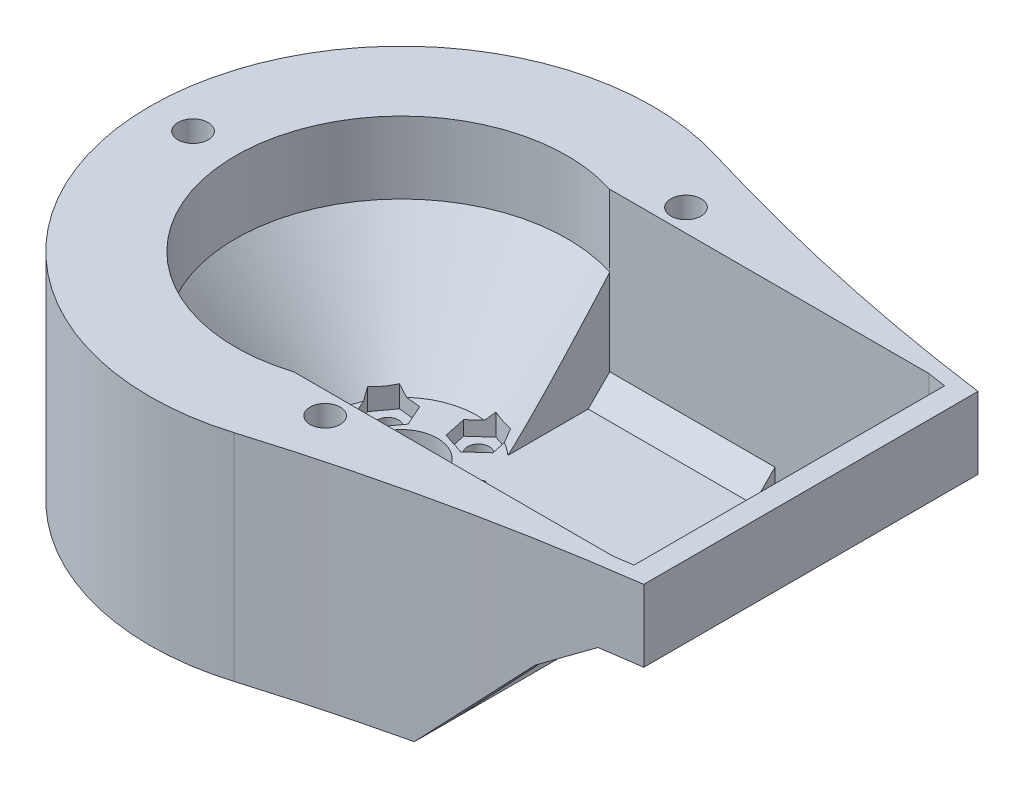
from build123d import *
from OCP.BRepFilletAPI import BRepFilletAPI_MakeChamfer

# Parameters (mm, degrees)
BOSS_EXTRUDE1_DEPTH      = 25
CUT_EXTRUDE1_DEPTH       = 40
CUT_EXTRUDE2_DEPTH       = 79.530097516
BOSS_EXTRUDE2_START      = 5
BOSS_EXTRUDE2_DEPTH      = 5
SKETCH23_R               = 16
BOSS_EXTRUDE3_DEPTH      = 5
SKETCH24_R               = 12.5
BOSS_EXTRUDE4_DEPTH      = 6.5
SKETCH25_R               = 5
SKETCH25_R_2             = 1.5
CUT_EXTRUDE6_DEPTH       = 86.230430105
SKETCH28_R               = 23.086792761
CUT_EXTRUDE9_DEPTH       = 10
SKETCH29_R               = 23.086792761
CUT_EXTRUDE10_DEPTH      = 15
CUT_EXTRUDE10_DRAFT      = -40
CHAMFER1_SIZE            = 17
CHAMFER1_SIZE_2          = 5
CUT_EXTRUDE8_DEPTH       = 28.25
CHAMFER2_SIZE            = 3
BOSS_EXTRUDE5_START      = -10
BOSS_EXTRUDE5_DEPTH      = 10
SKETCH31_R               = 2.1
CUT_EXTRUDE11_DEPTH      = 79.716262615
SKETCH32_R               = 4
CUT_EXTRUDE12_DEPTH      = 5
CUT_EXTRUDE13_DEPTH      = 15
CUT_EXTRUDE13_DEPTH_BACK = 2


with BuildPart() as part:
    # Sketch1 → Boss-Extrude1 (new body)
    with BuildSketch(Plane(origin=(0, 0, 0), x_dir=(1, 0, 0), z_dir=(0, 1, 0))):
        with BuildLine():
            ThreePointArc((10.176119403, 33.488006717), (-35, 0), (10.176119403, -33.488006717))
            ThreePointArc((10.176119403, -33.488006717), (90.981320941, -20.596737889), (172.264048338, -30.019244692))
            ThreePointArc((172.264048338, -30.019244692), (211, 0), (172.264048338, 30.019244692))
            ThreePointArc((172.264048338, 30.019244692), (90.981320941, 20.596737889), (10.176119403, 33.488006717))
        make_face()
    extrude(amount=BOSS_EXTRUDE1_DEPTH)

    # Sketch20 → Cut-Extrude1 (cut, symmetric)
    with BuildSketch(Plane.XY):
        Polygon((211, 0), (30, 0), (65.703700169, 25), (211, 25), align=None)
    extrude(amount=CUT_EXTRUDE1_DEPTH, both=True, mode=Mode.SUBTRACT)

    # Sketch21 → Cut-Extrude2 (cut, through all)
    with BuildSketch(Plane.XZ):
        Polygon((7, -22), (51, -22), (56, -22), (56, 22), (51, 22), (7, 22), align=None)
    extrude(amount=-CUT_EXTRUDE2_DEPTH, mode=Mode.SUBTRACT)

    # Sketch22 → Boss-Extrude2 (add)
    with BuildSketch(Plane.XZ.offset(BOSS_EXTRUDE2_START)):
        with BuildLine():
            Line((30, 28.197361151), (30, -28.197361151))
            ThreePointArc((30, -28.197361151), (20.042816459, -30.673158945), (10.176119403, -33.488006717))
            ThreePointArc((10.176119403, -33.488006717), (-35, 0), (10.176119403, 33.488006717))
            ThreePointArc((10.176119403, 33.488006717), (20.042816459, 30.673158945), (30, 28.197361151))
        make_face()
    extrude(amount=-BOSS_EXTRUDE2_DEPTH)

    # Sketch23 → Boss-Extrude3 (add)
    with BuildSketch(Plane.XZ.offset(5)):
        with Locations(Location((0, 0, 0), (0, 0, 270))):
            Circle(SKETCH23_R)
    extrude(amount=BOSS_EXTRUDE3_DEPTH)

    # Sketch24 → Boss-Extrude4 (add)
    with BuildSketch(Plane.XZ.offset(10)):
        with Locations(Location((0, 0, 0), (0, 0, 90))):
            Circle(SKETCH24_R)
    extrude(amount=BOSS_EXTRUDE4_DEPTH)

    # Sketch25 → Cut-Extrude6 (cut, through all)
    with BuildSketch(Plane.XZ.offset(16.5)):
        with Locations(Location((0, 0, 0), (0, 0, 270))):
            Circle(SKETCH25_R)
        with Locations(Location((8.5, 0, 0), (0, 0, 270))):
            Circle(SKETCH25_R_2)
        with Locations(Location((2.626644452, -8.083980389, 0), (0, 0, 270))):
            Circle(SKETCH25_R_2)
        with Locations(Location((-6.876644452, -4.996174644, 0), (0, 0, 270))):
            Circle(SKETCH25_R_2)
        with Locations(Location((-6.876644452, 4.996174644, 0), (0, 0, 270))):
            Circle(SKETCH25_R_2)
        with Locations(Location((2.626644452, 8.083980389, 0), (0, 0, 270))):
            Circle(SKETCH25_R_2)
    extrude(amount=-CUT_EXTRUDE6_DEPTH, mode=Mode.SUBTRACT)

    # Sketch28 → Cut-Extrude9 (cut)
    with BuildSketch(Plane(origin=(0, 25, 0), x_dir=(1, 0, 0), z_dir=(0, 1, 0))):
        Circle(SKETCH28_R)
    extrude(amount=-CUT_EXTRUDE9_DEPTH, mode=Mode.SUBTRACT)


with BuildPart() as cut_extrude10_tool:
    # Sketch29 → Cut-Extrude10 (with draft: the straight prism first)
    with BuildSketch(Plane(origin=(0, 15, 0), x_dir=(1, 0, 0), z_dir=(0, 1, 0))):
        Circle(SKETCH29_R)
    extrude(amount=-CUT_EXTRUDE10_DEPTH)
    # Cut-Extrude10: the draft: its side faces are tilted about the plane it starts from
    cut_extrude10_sides = [cut_extrude10_tool.faces().sort_by_distance(p)[0] for p in [
        (-23.086792761, 7.5, 0),
    ]]
    draft(cut_extrude10_sides, Plane(origin=(0, 15, 0), x_dir=(1, 0, 0), z_dir=(0, 1, 0)), CUT_EXTRUDE10_DRAFT)


with BuildPart() as part_1:
    add(part.part)

    # Cut-Extrude10: cut by cut_extrude10_tool
    add(cut_extrude10_tool.part, mode=Mode.SUBTRACT)

    # Chamfer1
    chamfer1_edges_1 = [part_1.edges().sort_by_distance(p)[0] for p in [
        (30, 0, 25.098680576),
    ]]
    chamfer1_side_1 = [part_1.faces().sort_by_distance(p)[0] for p in [
        (30.081915204, 0.057357644, 25.098680576),
    ]]
    chamfer1_edges_2 = [part_1.edges().sort_by_distance(p)[0] for p in [
        (30, 0, -25.098680576),
    ]]
    chamfer1_side_2 = [part_1.faces().sort_by_distance(p)[0] for p in [
        (30.081915204, 0.057357644, -25.098680576),
    ]]
    chamfer1 = BRepFilletAPI_MakeChamfer(part_1.part.solid().wrapped)
    for e in chamfer1_edges_1:
        chamfer1.Add(CHAMFER1_SIZE - 0.0001, CHAMFER1_SIZE_2 - 0.0001, e.wrapped, chamfer1_side_1[0].wrapped)
    for e in chamfer1_edges_2:
        chamfer1.Add(CHAMFER1_SIZE - 0.0001, CHAMFER1_SIZE_2 - 0.0001, e.wrapped, chamfer1_side_2[0].wrapped)
    add(Compound.cast(chamfer1.Shape()), mode=Mode.REPLACE)  # a hair under: the kernel refuses the full size

    # Sketch27 → Cut-Extrude8 (cut, symmetric)
    with BuildSketch(Plane.XY):
        Polygon((65.703700169, 25), (51.422220101, 25), (51.422220101, 15), align=None)
    extrude(amount=CUT_EXTRUDE8_DEPTH, both=True, mode=Mode.SUBTRACT)

    # Chamfer2
    chamfer2_edges = [part_1.edges().sort_by_distance(p)[0] for p in [
        (18.5, 0, -22),
        (18.5, 0, 22),
    ]]
    chamfer(chamfer2_edges, length=CHAMFER2_SIZE)

    # Sketch30 → Boss-Extrude5 (add)
    with BuildSketch(Plane(origin=(0, 25, 0), x_dir=(1, 0, 0), z_dir=(0, 1, 0)).offset(BOSS_EXTRUDE5_START)):
        with BuildLine():
            ThreePointArc((51.422220101, 22), (52.710694075, 21.804400431), (54, 21.614362006))
            Line((54, 21.614362006), (54, -21.614362006))
            ThreePointArc((54, -21.614362006), (52.710694075, -21.804400431), (51.422220101, -22))
            Line((51.422220101, -22), (51.422220101, -24.072260243))
            ThreePointArc((51.422220101, -24.072260243), (54.209204207, -23.653418764), (57, -23.26077716))
            Line((57, -23.26077716), (57, 23.26077716))
            ThreePointArc((57, 23.26077716), (54.209204207, 23.653418764), (51.422220101, 24.072260243))
            Line((51.422220101, 24.072260243), (51.422220101, 22))
        make_face()
    extrude(amount=BOSS_EXTRUDE5_DEPTH)

    # Sketch31 → Cut-Extrude11 (cut, through all)
    with BuildSketch(Plane(origin=(0, 25, 0), x_dir=(1, 0, 0), z_dir=(0, 1, 0))):
        with Locations(Location((-29, 0, 0), (0, 0, 270))):
            Circle(SKETCH31_R)
        with Locations(Location((14.5, 25.11473671, 0), (0, 0, 270))):
            Circle(SKETCH31_R)
        with Locations(Location((14.5, -25.11473671, 0), (0, 0, 270))):
            Circle(SKETCH31_R)
    extrude(amount=-CUT_EXTRUDE11_DEPTH, mode=Mode.SUBTRACT)

    # Sketch32 → Cut-Extrude12 (cut)
    with BuildSketch(Plane.XZ.offset(5)):
        with Locations(Location((-29, 0, 0), (0, 0, 270))):
            Circle(SKETCH32_R)
        with Locations(Location((14.5, 25.11473671, 0), (0, 0, 270))):
            Circle(SKETCH32_R)
        with Locations(Location((14.5, -25.11473671, 0), (0, 0, 270))):
            Circle(SKETCH32_R)
    extrude(amount=-CUT_EXTRUDE12_DEPTH, mode=Mode.SUBTRACT)

    # Sketch33 → Cut-Extrude13 (cut, two sides: drawn at the far end of the back side and taken through both)
    with BuildSketch(Plane(origin=(0, 0, 0), x_dir=(1, 0, 0), z_dir=(0, 1, 0)).offset(-CUT_EXTRUDE13_DEPTH_BACK)):
        Polygon((5.646654499, -7.102719642), (3.286852741, -4.977944595), (0.266842694, -5.959205342), (-0.393365594, -9.065241135), (1.966436164, -11.190016182), (4.98644621, -10.208755435), align=None)
        Polygon((8.5, 3.175426481), (5.75, 1.58771324), (5.75, -1.58771324), (8.5, -3.175426481), (11.25, -1.58771324), (11.25, 1.58771324), align=None)
        Polygon((-5.010175597, -7.565148632), (-3.71861329, -4.664252194), (-5.585082145, -2.095278207), (-8.743113307, -2.427200657), (-10.034675614, -5.328097095), (-8.168206759, -7.897071082), align=None)
        Polygon((-8.743113307, 2.427200657), (-5.585082145, 2.095278207), (-3.71861329, 4.664252194), (-5.010175597, 7.565148632), (-8.168206759, 7.897071082), (-10.034675614, 5.328097095), align=None)
        Polygon((-0.393365594, 9.065241135), (0.266842694, 5.959205342), (3.286852741, 4.977944595), (5.646654499, 7.102719642), (4.98644621, 10.208755435), (1.966436164, 11.190016182), align=None)
    extrude(amount=CUT_EXTRUDE13_DEPTH + CUT_EXTRUDE13_DEPTH_BACK, mode=Mode.SUBTRACT)


solid = part_1.part
